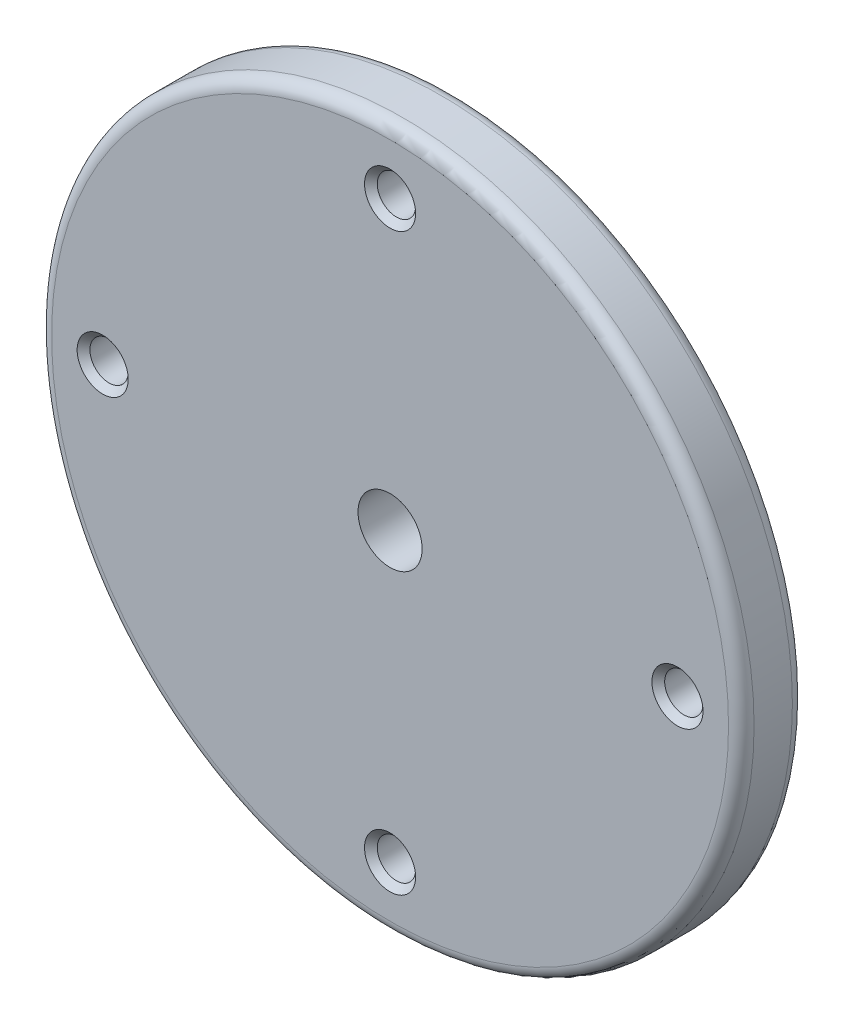
from build123d import *

# Parameters (mm, degrees)
ESQUISSE1_R        = 27.5
ESQUISSE1_R_2      = 1.5
ESQUISSE1_R_3      = 2.51
BOSS_EXTRU_2_DEPTH = 5
CONG_1_R           = 1
CHANFREIN1_SIZE    = 0.5


with BuildPart() as part:
    # Esquisse1 → Boss.-Extru.2 (new body)
    with BuildSketch(Plane.XY):
        Circle(ESQUISSE1_R)
        with Locations((0, -22.5)):
            Circle(ESQUISSE1_R_2, mode=Mode.SUBTRACT)
        with Locations((22.5, 0)):
            Circle(ESQUISSE1_R_2, mode=Mode.SUBTRACT)
        with Locations((0, 22.5)):
            Circle(ESQUISSE1_R_2, mode=Mode.SUBTRACT)
        with Locations((-22.5, 0)):
            Circle(ESQUISSE1_R_2, mode=Mode.SUBTRACT)
        Circle(ESQUISSE1_R_3, mode=Mode.SUBTRACT)
    extrude(amount=BOSS_EXTRU_2_DEPTH)

    # Congé1
    cong_1_edges = [part.edges().sort_by_distance(p)[0] for p in [
        (-27.5, 0, 5),
        (-27.5, 0, 0),
    ]]
    fillet(cong_1_edges, radius=CONG_1_R)

    # Chanfrein1
    chanfrein1_edges = [part.edges().sort_by_distance(p)[0] for p in [
        (21, 0, 5),
        (-1.5, -22.5, 5),
        (-24, 0, 5),
        (-1.5, 22.5, 5),
    ]]
    chamfer(chanfrein1_edges, length=CHANFREIN1_SIZE)


solid = part.part
